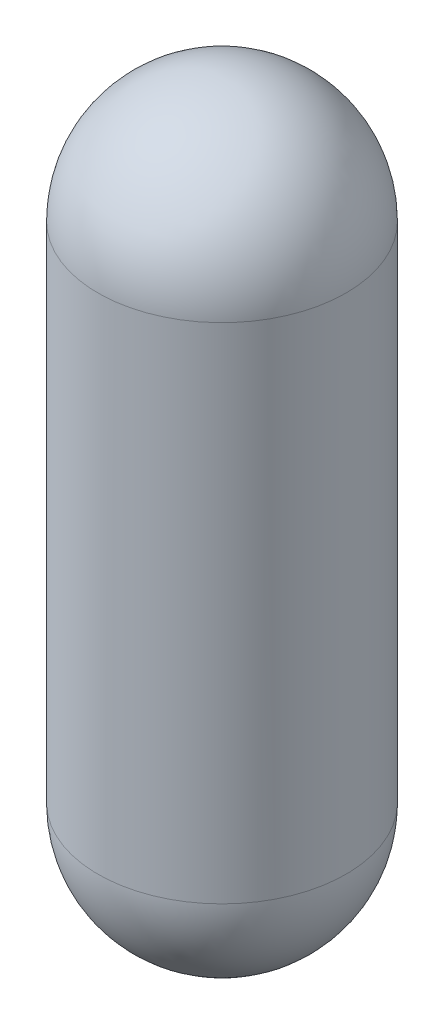
from build123d import *


with BuildPart() as part:
    # Sketch1 → Revolve1 (revolve)
    with BuildSketch(Plane.XY):
        with BuildLine():
            Line((0, 1339.6), (0, 1669.8))
            ThreePointArc((0, 1669.8), (233.486659148, 1573.086659148), (330.2, 1339.6))
            Line((330.2, 1339.6), (330.2, 0))
            ThreePointArc((330.2, 0), (233.486659148, -233.486659148), (0, -330.2))
            Line((0, -330.2), (0, 0))
            Line((0, 0), (0, 1339.6))
        make_face()
    revolve(axis=Axis((0, 0, 0), (0, 1, 0)))


solid = part.part
